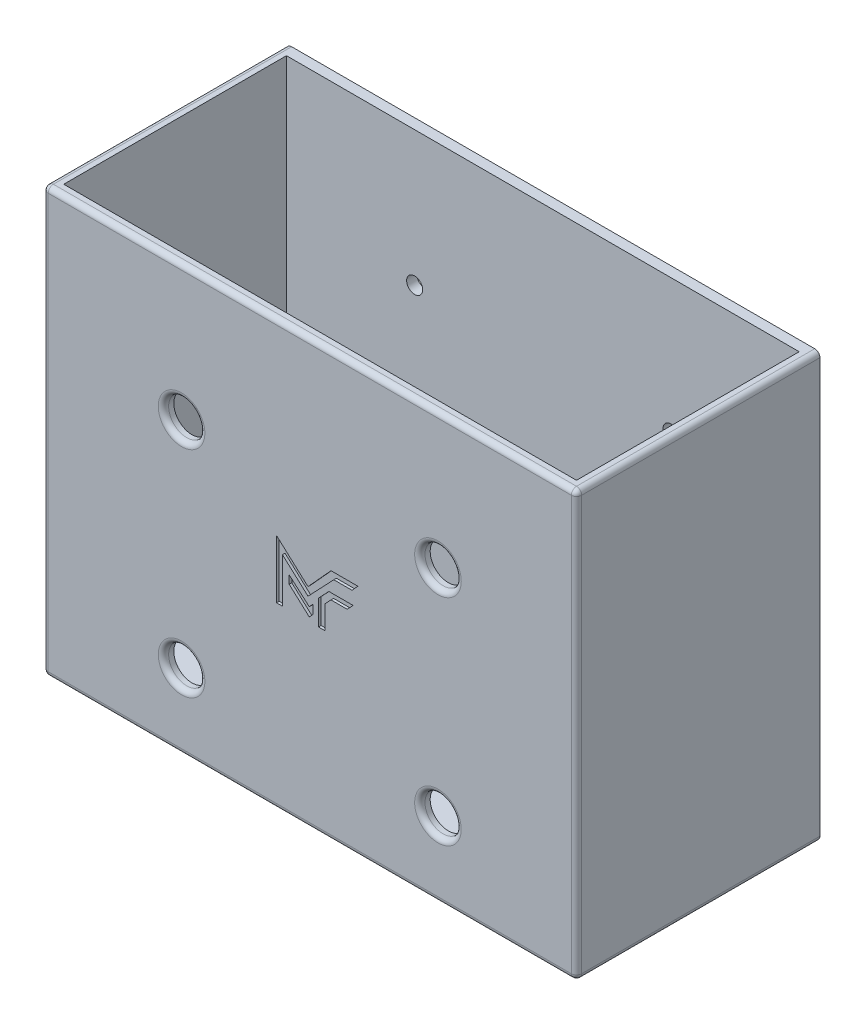
from build123d import *

# Parameters (mm, degrees)
ESBO_O1_W                = 103
ESBO_O1_H                = 47
RESSALTO_EXTRUS_O1_DEPTH = 2
ESBO_O2_W                = 103
ESBO_O2_H                = 47
ESBO_O2_W_2              = 99
ESBO_O2_H_2              = 43
RESSALTO_EXTRUS_O2_DEPTH = 80
ESBO_O3_W                = 99
ESBO_O3_H                = 3
RESSALTO_EXTRUS_O3_DEPTH = 3
FILETE1_R                = 5
ESBO_O4_R                = 1.55
CORTE_EXTRUS_O1_DEPTH    = 3
ESBO_O5_R                = 3.5
CORTE_EXTRUS_O2_DEPTH    = 3
FILETE2_R                = 1
FILETE3_R                = 1
CORTE_EXTRUS_O3_DEPTH    = 3
FILETE4_R                = 1
CORTE_EXTRUS_O4_DEPTH    = 0.5
CORTE_EXTRUS_O5_DEPTH    = 0.5


# Some blends are built 0.0001 mm under size
with BuildPart() as part:
    # Esboço1 → Ressalto-extrusão1 (new body)
    with BuildSketch(Plane(origin=(0, 0, 0), x_dir=(1, 0, 0), z_dir=(0, 1, 0))):
        with Locations((0, 23.5)):
            Rectangle(ESBO_O1_W, ESBO_O1_H)
    extrude(amount=-RESSALTO_EXTRUS_O1_DEPTH)

    # Esboço2 → Ressalto-extrusão2 (add)
    with BuildSketch(Plane(origin=(0, 0, 0), x_dir=(1, 0, 0), z_dir=(0, 1, 0))):
        with Locations((0, 23.5)):
            Rectangle(ESBO_O2_W, ESBO_O2_H)
        with Locations((0, 23.5)):
            Rectangle(ESBO_O2_W_2, ESBO_O2_H_2, mode=Mode.SUBTRACT)
    extrude(amount=RESSALTO_EXTRUS_O2_DEPTH)

    # Esboço3 → Ressalto-extrusão3 (add)
    with BuildSketch(Plane.XY.offset(-45)):
        with Locations((0, 26.5)):
            Rectangle(ESBO_O3_W, ESBO_O3_H)
    extrude(amount=RESSALTO_EXTRUS_O3_DEPTH)

    # Filete1
    # the kernel refuses this fillet: 5 mm, written as the material it adds along each edge
    with BuildSketch(Plane(origin=(49.5, 25, -45), x_dir=(0, -1, 0), z_dir=(-1, 0, 0))) as filete1_piece_1:
        with BuildLine():
            CenterArc((4.582575695, 5), FILETE1_R, 203.578178478, 66.421821522)
            Line((0, 3), (-0.091651514, 2.96))
            ThreePointArc((-0.091651514, 2.96), (-0.1, 1.5), (-0.1, 0))
            Line((-0.1, 0), (0, -0.1))
            Line((0, -0.1), (4.582575695, -0.1))
            Line((4.582575695, -0.1), (4.582575695, 0))
        make_face()
    extrude(amount=99)

    # Esboço4 → Corte-extrusão1 (cut)
    with BuildSketch(Plane.XY.offset(-45)):
        with Locations((24.75, 12.5)):
            Circle(ESBO_O4_R)
        with Locations((24.75, 54)):
            Circle(ESBO_O4_R)
        with Locations(Location((-24.75, 12.5, 0), (0, 0, 180))):
            Circle(ESBO_O4_R)
        with Locations(Location((-24.75, 54, 0), (0, 0, 180))):
            Circle(ESBO_O4_R)
    extrude(amount=-CORTE_EXTRUS_O1_DEPTH, mode=Mode.SUBTRACT)

    # Esboço5 → Corte-extrusão2 (cut)
    with BuildSketch(Plane.XY):
        with Locations((-24.75, 54)):
            Circle(ESBO_O5_R)
        with Locations((24.75, 54)):
            Circle(ESBO_O5_R)
        with Locations((-24.75, 12.5)):
            Circle(ESBO_O5_R)
        with Locations((24.75, 12.5)):
            Circle(ESBO_O5_R)
    extrude(amount=-CORTE_EXTRUS_O2_DEPTH, mode=Mode.SUBTRACT)

    # Filete2
    filete2_edges = [part.edges().sort_by_distance(p)[0] for p in [
        (21.25, 54, 0),
        (-28.25, 12.5, 0),
        (21.25, 12.5, 0),
        (-28.25, 54, 0),
    ]]
    fillet(filete2_edges, radius=FILETE2_R)

    # Filete3
    filete3_edges = [part.edges().sort_by_distance(p)[0] for p in [
        (-51.5, -2, -23.5),
        (51.5, 80, -23.5),
        (0, -2, 0),
        (-51.5, 80, -23.5),
        (0, 80, 0),
        (51.5, -2, -23.5),
        (51.5, 39, 0),
        (-51.5, 39, 0),
    ]]
    fillet(filete3_edges, radius=FILETE3_R)

    # Esboço6 → Corte-extrusão3 (cut)
    with BuildSketch(Plane.XZ.offset(2)):
        with BuildLine():
            Line((12, -17.5), (32, -17.5))
            ThreePointArc((32, -17.5), (38, -23.5), (32, -29.5))
            Line((32, -29.5), (12, -29.5))
            ThreePointArc((12, -29.5), (6, -23.5), (12, -17.5))
        make_face()
        with BuildLine():
            Line((-12, -17.5), (-32, -17.5))
            ThreePointArc((-32, -17.5), (-38, -23.5), (-32, -29.5))
            Line((-32, -29.5), (-12, -29.5))
            ThreePointArc((-12, -29.5), (-6, -23.5), (-12, -17.5))
        make_face()
    extrude(amount=-CORTE_EXTRUS_O3_DEPTH, mode=Mode.SUBTRACT)

    # Filete4
    filete4_edges = [part.edges().sort_by_distance(p)[0] for p in [
        (22, -2, -17.5),
        (38, -2, -23.5),
        (22, -2, -29.5),
        (-22, -2, -17.5),
        (-6, -2, -23.5),
        (-22, -2, -29.5),
        (6, -2, -23.5),
        (-38, -2, -23.5),
        (6, 0, -23.5),
        (22, 0, -29.5),
        (38, 0, -23.5),
        (-38, 0, -23.5),
        (-22, 0, -29.5),
        (-6, 0, -23.5),
        (22, 0, -17.5),
        (-22, 0, -17.5),
    ]]
    fillet(filete4_edges, radius=FILETE4_R - 0.0001)  # a hair under: the kernel refuses the full size

    # Esboço7 → Corte-extrusão4 (cut)
    # profile 1 of 4: a face of its own
    with BuildSketch(Plane.XZ.offset(2)):
        with BuildLine():
            Line((-18.301282051, -9.607171474), (-18.761919071, -10.047475962))
            add(Edge.make_bspline(
                [(-18.761919071, -10.047475962), (-18.800994055, -10.007072362), (-18.877319742, -9.928151474), (-19.000309147, -9.823667173), (-19.12821365, -9.736593645), (-19.258545124, -9.663260875), (-19.393647856, -9.607779407), (-19.531959688, -9.567349128), (-19.674363783, -9.542700314), (-19.770737398, -9.539880054), (-19.819210737, -9.538461538)],
                knots=[0, 0, 0, 0, 1.115251505, 2.178435587, 3.19620269, 4.182487026, 5.141301733, 6.088180966, 7.038406374, 8, 8, 8, 8], degree=3))
            add(Edge.make_bspline(
                [(-19.819210737, -9.538461538), (-19.859691866, -9.539582215), (-19.939576915, -9.541793747), (-20.0568691, -9.558006457), (-20.169065136, -9.585576876), (-20.27654909, -9.623574021), (-20.379004683, -9.67274031), (-20.476646728, -9.733037689), (-20.569234492, -9.803921587), (-20.655544944, -9.885025248), (-20.734498712, -9.973637093), (-20.804259394, -10.068185719), (-20.862695155, -10.168454522), (-20.910652433, -10.273428053), (-20.948009299, -10.383592182), (-20.974686795, -10.49887274), (-20.990116346, -10.61940702), (-20.99241931, -10.701345325), (-20.993589744, -10.742988782)],
                knots=[0, 0, 0, 0, 1.035432265, 2.043311493, 3.022114605, 3.98653278, 4.95457646, 5.923598177, 6.917315552, 7.932509744, 8.948865224, 9.949768934, 10.933144597, 11.912367597, 12.897413939, 13.903909035, 14.934704909, 16, 16, 16, 16], degree=3))
            add(Edge.make_bspline(
                [(-20.993589744, -10.742988782), (-20.993252438, -10.772217074), (-20.992587601, -10.829826638), (-20.98530979, -10.915047172), (-20.973590798, -10.997731236), (-20.956630512, -11.077753588), (-20.935421509, -11.155183575), (-20.910538518, -11.23068918), (-20.879323173, -11.303227088), (-20.844673668, -11.373639779), (-20.804376694, -11.440005953), (-20.760929122, -11.503291609), (-20.713817323, -11.563186525), (-20.662736153, -11.61944585), (-20.606966706, -11.671190376), (-20.547950417, -11.719976123), (-20.484691762, -11.764581818), (-20.418504785, -11.80612689), (-20.348817713, -11.842217448), (-20.277521318, -11.874908521), (-20.203534604, -11.901458533), (-20.127758402, -11.922860265), (-20.05046351, -11.941059241), (-19.970893913, -11.95226491), (-19.889739379, -11.960750832), (-19.834892536, -11.961274788), (-19.807291667, -11.961538462)],
                knots=[0, 0, 0, 0, 1.103660481, 2.175337485, 3.227646561, 4.255952547, 5.262355991, 6.258840057, 7.255597736, 8.242457506, 9.22035537, 10.185017736, 11.140346927, 12.096287581, 13.051739095, 14.01125915, 14.986044842, 15.97314143, 16.960198552, 17.947847494, 18.933482797, 19.925264591, 20.920966487, 21.929612487, 22.958107872, 24, 24, 24, 24], degree=3))
            add(Edge.make_bspline(
                [(-19.807291667, -11.961538462), (-19.76047585, -11.9601843), (-19.668494943, -11.957523724), (-19.533499738, -11.936718397), (-19.404862755, -11.902494811), (-19.302082422, -11.862078745), (-19.221556746, -11.822167355), (-19.160253739, -11.785251285), (-19.096861652, -11.743956608), (-19.032433373, -11.696724817), (-18.966244212, -11.644122713), (-18.89946256, -11.584998212), (-18.830378795, -11.521298199), (-18.785122706, -11.475834248), (-18.761919071, -11.452524038)],
                knots=[0, 0, 0, 0, 1.404581149, 2.759636711, 4.088442092, 5.392261763, 6.066678138, 6.783632037, 7.538459478, 8.336747902, 9.180226004, 10.074962426, 11.012997595, 12, 12, 12, 12], degree=3))
            Line((-18.761919071, -11.452524038), (-18.315304487, -11.921574519))
            add(Edge.make_bspline(
                [(-18.315304487, -11.921574519), (-18.346699088, -11.951885021), (-18.407974636, -12.011044639), (-18.500407099, -12.095045775), (-18.592723232, -12.170530135), (-18.682692869, -12.240237468), (-18.771789808, -12.302137032), (-18.860004599, -12.356290645), (-18.946338612, -12.404067932), (-19.032584602, -12.444663151), (-19.119279235, -12.479132709), (-19.208477824, -12.508808735), (-19.300453058, -12.533913586), (-19.395766679, -12.554169904), (-19.493529661, -12.570412736), (-19.594656934, -12.581376554), (-19.698507303, -12.588747163), (-19.768950617, -12.589409474), (-19.804487179, -12.58974359)],
                knots=[0, 0, 0, 0, 1.244526981, 2.429050516, 3.560637417, 4.644440555, 5.67424972, 6.652764056, 7.595344123, 8.486817594, 9.369275933, 10.254498637, 11.166417451, 12.086725134, 13.032340136, 13.991389299, 14.986715468, 16, 16, 16, 16], degree=3))
            add(Edge.make_bspline(
                [(-19.804487179, -12.58974359), (-19.869763443, -12.588079568), (-19.997490947, -12.584823539), (-20.184672274, -12.56069857), (-20.36248951, -12.520253485), (-20.531375251, -12.463052978), (-20.691275795, -12.389982012), (-20.842150235, -12.300400439), (-20.983755395, -12.194546263), (-21.114947384, -12.073660197), (-21.233616782, -11.940151686), (-21.338506787, -11.796800172), (-21.425271803, -11.642901134), (-21.497314666, -11.480728154), (-21.553651237, -11.309541172), (-21.593302632, -11.129155018), (-21.617755358, -10.939743864), (-21.620430521, -10.810371679), (-21.621794872, -10.744391026)],
                knots=[0, 0, 0, 0, 1.078019885, 2.10938526, 3.111377082, 4.085535484, 5.04941344, 6.010039228, 6.978205633, 7.964457913, 8.951525778, 9.924444315, 10.892603023, 11.863865945, 12.85144698, 13.863884204, 14.910567087, 16, 16, 16, 16], degree=3))
            add(Edge.make_bspline(
                [(-21.621794872, -10.744391026), (-21.621218363, -10.701359006), (-21.620075865, -10.616080062), (-21.608068097, -10.490457267), (-21.591328571, -10.367997513), (-21.564772836, -10.249972337), (-21.532762515, -10.134791723), (-21.492953476, -10.023707549), (-21.445409299, -9.916400549), (-21.391662445, -9.812691083), (-21.330859166, -9.71325856), (-21.262935229, -9.618957263), (-21.18963926, -9.529059201), (-21.109210077, -9.444757041), (-21.022816421, -9.365310593), (-20.930068235, -9.291150392), (-20.831523352, -9.221212897), (-20.726915049, -9.157301627), (-20.618275586, -9.099490486), (-20.506975192, -9.048498591), (-20.393287319, -9.005881109), (-20.277692652, -8.970531479), (-20.159702802, -8.944145481), (-20.040159952, -8.924172131), (-19.918046935, -8.913006901), (-19.836058624, -8.911179081), (-19.794671474, -8.91025641)],
                knots=[0, 0, 0, 0, 1.071919942, 2.124283339, 3.142214191, 4.149696895, 5.136002878, 6.119640489, 7.086990633, 8.058538607, 9.028339693, 9.988281803, 10.952401235, 11.916291999, 12.888973767, 13.874849856, 14.873389453, 15.898127285, 16.927174885, 17.938320013, 18.946391617, 19.950418109, 20.947802303, 21.956882652, 22.968648068, 24, 24, 24, 24], degree=3))
            add(Edge.make_bspline(
                [(-19.794671474, -8.91025641), (-19.759363992, -8.910785308), (-19.689116127, -8.911837605), (-19.584505268, -8.920609646), (-19.480731038, -8.934386047), (-19.37816498, -8.955171702), (-19.276073437, -8.979846901), (-19.175798006, -9.012155671), (-19.075756788, -9.048169883), (-18.977518782, -9.091217521), (-18.88094686, -9.138207905), (-18.788303373, -9.191520203), (-18.698032845, -9.247873635), (-18.612135617, -9.310603444), (-18.529002648, -9.377434303), (-18.449068648, -9.448678016), (-18.373035085, -9.525522424), (-18.325320643, -9.579817534), (-18.301282051, -9.607171474)],
                knots=[0, 0, 0, 0, 0.996412454, 1.982464992, 2.961075852, 3.949442424, 4.934965278, 5.923860011, 6.921385422, 7.934793307, 8.949617135, 9.951082467, 10.950285876, 11.951772932, 12.951063433, 13.960125323, 14.972308753, 16, 16, 16, 16], degree=3))
        make_face()
    # profile 2 of 4: a face of its own
    with BuildSketch(Plane.XZ.offset(2)):
        Polygon((-23.955829327, -9), (-23.371794872, -9), (-21.958333333, -12.5), (-22.629306891, -12.5), (-22.901342147, -11.782051282), (-24.424879808, -11.782051282), (-24.697616186, -12.5), (-25.368589744, -12.5), align=None)
        Polygon((-23.663461538, -9.938802083), (-24.186498397, -11.153846154), (-23.139723558, -11.153846154), align=None, mode=Mode.SUBTRACT)
    # profile 3 of 4: a face of its own
    with BuildSketch(Plane.XZ.offset(2)):
        with BuildLine():
            Line((19.25, -9), (20.041566506, -9))
            add(Edge.make_bspline(
                [(20.041566506, -9), (20.10327822, -9.000431386), (20.222567661, -9.00126526), (20.395394461, -9.010661015), (20.556101392, -9.025111019), (20.704792049, -9.044989618), (20.841161593, -9.071294448), (20.965034178, -9.104288702), (21.076825549, -9.142375078), (21.177761476, -9.187191429), (21.269906269, -9.239442844), (21.357400691, -9.297646725), (21.440072949, -9.36393525), (21.519083216, -9.437029582), (21.593411849, -9.518266959), (21.664296686, -9.606301796), (21.730002143, -9.70241072), (21.792514356, -9.804289341), (21.849048335, -9.912369411), (21.898359383, -10.025730976), (21.939667547, -10.143644511), (21.97323257, -10.266235682), (21.999987767, -10.393097523), (22.018707839, -10.52448603), (22.030280774, -10.660279558), (22.031454751, -10.7523135), (22.032051282, -10.799078526)],
                knots=[0, 0, 0, 0, 1.44355588, 2.790409838, 4.047694926, 5.217575253, 6.298404546, 7.294384826, 8.214239204, 9.058592145, 9.873746385, 10.689560431, 11.514393297, 12.350027578, 13.205127629, 14.088021785, 14.991911688, 15.926770944, 16.882954281, 17.842803888, 18.816321264, 19.80318086, 20.814351908, 21.847355356, 22.906180909, 24, 24, 24, 24], degree=3))
            add(Edge.make_bspline(
                [(22.032051282, -10.799078526), (22.030489242, -10.865067021), (22.027414275, -10.994969237), (22.001512472, -11.185599243), (21.959620485, -11.368337116), (21.900716547, -11.541753411), (21.827691432, -11.704303829), (21.740454754, -11.853121863), (21.640285608, -11.987408732), (21.528350968, -12.106495799), (21.407153016, -12.208852746), (21.281203903, -12.296513981), (21.149276656, -12.365642179), (21.033030315, -12.409479795), (20.932230234, -12.436742999), (20.843728854, -12.452855815), (20.743200316, -12.467632239), (20.629707279, -12.479051142), (20.503747612, -12.489233997), (20.36481924, -12.494766964), (20.213371971, -12.499364038), (20.108177523, -12.499782458), (20.053485577, -12.5)],
                knots=[0, 0, 0, 0, 1.315458931, 2.589557908, 3.828601765, 5.048913369, 6.235739168, 7.376350998, 8.481830359, 9.569842114, 10.627874879, 11.640079404, 12.624025415, 13.590060155, 14.111227486, 14.704434459, 15.382649715, 16.137166398, 16.978595427, 17.902333227, 18.909396075, 20, 20, 20, 20], degree=3))
            Line((20.053485577, -12.5), (19.25, -12.5))
            Line((19.25, -12.5), (19.25, -9))
        make_face()
        with BuildLine():
            Line((19.878205128, -9.628205128), (19.878205128, -11.871794872))
            Line((19.878205128, -11.871794872), (20.206330128, -11.871794872))
            add(Edge.make_bspline(
                [(20.206330128, -11.871794872), (20.245371964, -11.871723331), (20.320462411, -11.871585734), (20.42887602, -11.86503188), (20.529131118, -11.858453619), (20.620951728, -11.845967858), (20.705006092, -11.832059598), (20.780139522, -11.812704351), (20.847900844, -11.792373304), (20.907462369, -11.766489361), (20.962015872, -11.73735526), (21.012526184, -11.703221283), (21.061282778, -11.66531679), (21.107374108, -11.622526954), (21.15097462, -11.575418393), (21.191826346, -11.523748379), (21.230474547, -11.467674558), (21.265927198, -11.406900454), (21.29832402, -11.342067854), (21.327063632, -11.273804758), (21.350893011, -11.20154268), (21.370698531, -11.125958081), (21.384851822, -11.04639291), (21.39656097, -10.963436497), (21.402597377, -10.876760174), (21.403425836, -10.817782708), (21.403846154, -10.787860577)],
                knots=[0, 0, 0, 0, 1.50275155, 2.890291501, 4.180787663, 5.369391935, 6.45668281, 7.458360028, 8.354766181, 9.177074746, 9.954075863, 10.732690366, 11.5210699, 12.329727389, 13.151100085, 13.990027547, 14.863562427, 15.770965086, 16.696477834, 17.652329173, 18.619756807, 19.62365428, 20.657822005, 21.729286259, 22.847956731, 24, 24, 24, 24], degree=3))
            add(Edge.make_bspline(
                [(21.403846154, -10.787860577), (21.403009024, -10.74200774), (21.401376685, -10.652598261), (21.385634766, -10.522371404), (21.360009925, -10.399743308), (21.323445745, -10.285169081), (21.277355464, -10.178326708), (21.219662732, -10.080121371), (21.152850424, -9.988903355), (21.100017073, -9.93539194), (21.073617788, -9.908653846)],
                knots=[0, 0, 0, 0, 1.13821349, 2.219428113, 3.251817212, 4.244760574, 5.201143372, 6.134805572, 7.068016741, 8, 8, 8, 8], degree=3))
            add(Edge.make_bspline(
                [(21.073617788, -9.908653846), (21.047585594, -9.885869376), (20.994417785, -9.839334675), (20.901072585, -9.783574203), (20.798211008, -9.734583163), (20.683479891, -9.695738732), (20.557988059, -9.665018899), (20.420988079, -9.643832182), (20.273213618, -9.630217823), (20.170838914, -9.6288904), (20.117988782, -9.628205128)],
                knots=[0, 0, 0, 0, 0.813307809, 1.661089106, 2.549956539, 3.493439533, 4.508053171, 5.589449661, 6.755572447, 8, 8, 8, 8], degree=3))
            Line((20.117988782, -9.628205128), (19.878205128, -9.628205128))
        make_face(mode=Mode.SUBTRACT)
    # profile 4 of 4: a face of its own
    with BuildSketch(Plane.XZ.offset(2)):
        with BuildLine():
            Line((25.801282051, -9.607171474), (25.340645032, -10.047475962))
            add(Edge.make_bspline(
                [(25.340645032, -10.047475962), (25.301570047, -10.007072362), (25.22524436, -9.928151474), (25.102254955, -9.823667173), (24.974350452, -9.736593645), (24.844018978, -9.663260875), (24.708916247, -9.607779407), (24.570604415, -9.567349128), (24.428200319, -9.542700314), (24.331826705, -9.539880054), (24.283353365, -9.538461538)],
                knots=[0, 0, 0, 0, 1.115251505, 2.178435587, 3.19620269, 4.182487026, 5.141301733, 6.088180966, 7.038406374, 8, 8, 8, 8], degree=3))
            add(Edge.make_bspline(
                [(24.283353365, -9.538461538), (24.242872236, -9.539582215), (24.162987188, -9.541793747), (24.045695003, -9.558006457), (23.933498966, -9.585576876), (23.826015013, -9.623574021), (23.723559419, -9.67274031), (23.625917374, -9.733037689), (23.53332961, -9.803921587), (23.447019159, -9.885025248), (23.36806539, -9.973637093), (23.298304709, -10.068185719), (23.239868948, -10.168454522), (23.191911669, -10.273428053), (23.154554803, -10.383592182), (23.127877307, -10.49887274), (23.112447757, -10.61940702), (23.110144793, -10.701345325), (23.108974359, -10.742988782)],
                knots=[0, 0, 0, 0, 1.035432265, 2.043311493, 3.022114605, 3.98653278, 4.95457646, 5.923598177, 6.917315552, 7.932509744, 8.948865224, 9.949768934, 10.933144597, 11.912367597, 12.897413939, 13.903909035, 14.934704909, 16, 16, 16, 16], degree=3))
            add(Edge.make_bspline(
                [(23.108974359, -10.742988782), (23.109311665, -10.772217074), (23.109976501, -10.829826638), (23.117254313, -10.915047172), (23.128973305, -10.997731236), (23.14593359, -11.077753588), (23.167142594, -11.155183575), (23.192025584, -11.23068918), (23.22324093, -11.303227088), (23.257890434, -11.373639779), (23.298187408, -11.440005953), (23.341634981, -11.503291609), (23.388746779, -11.563186525), (23.43982795, -11.61944585), (23.495597397, -11.671190376), (23.554613686, -11.719976123), (23.61787234, -11.764581818), (23.684059317, -11.80612689), (23.753746389, -11.842217448), (23.825042784, -11.874908521), (23.899029499, -11.901458533), (23.974805701, -11.922860265), (24.052100593, -11.941059241), (24.13167019, -11.95226491), (24.212824724, -11.960750832), (24.267671567, -11.961274788), (24.295272436, -11.961538462)],
                knots=[0, 0, 0, 0, 1.103660481, 2.175337485, 3.227646561, 4.255952547, 5.262355991, 6.258840057, 7.255597736, 8.242457506, 9.22035537, 10.185017736, 11.140346927, 12.096287581, 13.051739095, 14.01125915, 14.986044842, 15.97314143, 16.960198552, 17.947847494, 18.933482797, 19.925264591, 20.920966487, 21.929612487, 22.958107872, 24, 24, 24, 24], degree=3))
            add(Edge.make_bspline(
                [(24.295272436, -11.961538462), (24.342088253, -11.9601843), (24.434069159, -11.957523724), (24.569064365, -11.936718397), (24.697701347, -11.902494811), (24.80048168, -11.862078745), (24.881007357, -11.822167355), (24.942310364, -11.785251285), (25.005702451, -11.743956608), (25.07013073, -11.696724817), (25.136319891, -11.644122713), (25.203101543, -11.584998212), (25.272185307, -11.521298199), (25.317441397, -11.475834248), (25.340645032, -11.452524038)],
                knots=[0, 0, 0, 0, 1.404581149, 2.759636711, 4.088442092, 5.392261763, 6.066678138, 6.783632037, 7.538459478, 8.336747902, 9.180226004, 10.074962426, 11.012997595, 12, 12, 12, 12], degree=3))
            Line((25.340645032, -11.452524038), (25.787259615, -11.921574519))
            add(Edge.make_bspline(
                [(25.787259615, -11.921574519), (25.755865014, -11.951885021), (25.694589466, -12.011044639), (25.602157004, -12.095045775), (25.509840871, -12.170530135), (25.419871234, -12.240237468), (25.330774295, -12.302137032), (25.242559504, -12.356290645), (25.15622549, -12.404067932), (25.069979501, -12.444663151), (24.983284868, -12.479132709), (24.894086279, -12.508808735), (24.802111045, -12.533913586), (24.706797423, -12.554169904), (24.609034442, -12.570412736), (24.507907168, -12.581376554), (24.4040568, -12.588747163), (24.333613486, -12.589409474), (24.298076923, -12.58974359)],
                knots=[0, 0, 0, 0, 1.244526981, 2.429050516, 3.560637417, 4.644440555, 5.67424972, 6.652764056, 7.595344123, 8.486817594, 9.369275933, 10.254498637, 11.166417451, 12.086725134, 13.032340136, 13.991389299, 14.986715468, 16, 16, 16, 16], degree=3))
            add(Edge.make_bspline(
                [(24.298076923, -12.58974359), (24.232800659, -12.588079568), (24.105073155, -12.584823539), (23.917891829, -12.56069857), (23.740074593, -12.520253485), (23.571188852, -12.463052978), (23.411288308, -12.389982012), (23.260413867, -12.300400439), (23.118808707, -12.194546263), (22.987616718, -12.073660197), (22.86894732, -11.940151686), (22.764057315, -11.796800172), (22.677292299, -11.642901134), (22.605249437, -11.480728154), (22.548912866, -11.309541172), (22.50926147, -11.129155018), (22.484808744, -10.939743864), (22.482133581, -10.810371679), (22.480769231, -10.744391026)],
                knots=[0, 0, 0, 0, 1.078019885, 2.10938526, 3.111377082, 4.085535484, 5.04941344, 6.010039228, 6.978205633, 7.964457913, 8.951525778, 9.924444315, 10.892603023, 11.863865945, 12.85144698, 13.863884204, 14.910567087, 16, 16, 16, 16], degree=3))
            add(Edge.make_bspline(
                [(22.480769231, -10.744391026), (22.481345739, -10.701359006), (22.482488238, -10.616080062), (22.494496005, -10.490457267), (22.511235531, -10.367997513), (22.537791267, -10.249972337), (22.569801587, -10.134791723), (22.609610626, -10.023707549), (22.657154803, -9.916400549), (22.710901658, -9.812691083), (22.771704936, -9.71325856), (22.839628874, -9.618957263), (22.912924843, -9.529059201), (22.993354026, -9.444757041), (23.079747682, -9.365310593), (23.172495868, -9.291150392), (23.27104075, -9.221212897), (23.375649054, -9.157301627), (23.484288517, -9.099490486), (23.595588911, -9.048498591), (23.709276783, -9.005881109), (23.824871451, -8.970531479), (23.942861301, -8.944145481), (24.062404151, -8.924172131), (24.184517167, -8.913006901), (24.266505479, -8.911179081), (24.307892628, -8.91025641)],
                knots=[0, 0, 0, 0, 1.071919942, 2.124283339, 3.142214191, 4.149696895, 5.136002878, 6.119640489, 7.086990633, 8.058538607, 9.028339693, 9.988281803, 10.952401235, 11.916291999, 12.888973767, 13.874849856, 14.873389453, 15.898127285, 16.927174885, 17.938320013, 18.946391617, 19.950418109, 20.947802303, 21.956882652, 22.968648068, 24, 24, 24, 24], degree=3))
            add(Edge.make_bspline(
                [(24.307892628, -8.91025641), (24.34320011, -8.910785308), (24.413447975, -8.911837605), (24.518058834, -8.920609646), (24.621833065, -8.934386047), (24.724399123, -8.955171702), (24.826490666, -8.979846901), (24.926766097, -9.012155671), (25.026807314, -9.048169883), (25.125045321, -9.091217521), (25.221617243, -9.138207905), (25.31426073, -9.191520203), (25.404531258, -9.247873635), (25.490428486, -9.310603444), (25.573561455, -9.377434303), (25.653495454, -9.448678016), (25.729529017, -9.525522424), (25.777243459, -9.579817534), (25.801282051, -9.607171474)],
                knots=[0, 0, 0, 0, 0.996412454, 1.982464992, 2.961075852, 3.949442424, 4.934965278, 5.923860011, 6.921385422, 7.934793307, 8.949617135, 9.951082467, 10.950285876, 11.951772932, 12.951063433, 13.960125323, 14.972308753, 16, 16, 16, 16], degree=3))
        make_face()
    extrude(amount=-CORTE_EXTRUS_O4_DEPTH, mode=Mode.SUBTRACT)

    # Logo_MF → Corte-extrusão5 (cut)
    with BuildSketch(Plane.XY):
        Polygon((-6.412650279, 32.565433936), (-5.279058726, 32.565433936), (-5.279058726, 41.185329314), (-0.340076926, 36.698837038), (4.643002609, 41.941697965), (8.161859721, 41.941697965), (9.289841241, 43.183443153), (4.099342664, 43.183443153), (-0.338267392, 38.298273637), (-6.412650279, 43.816146147), align=None)
        Polygon((-3.970410445, 38.446133019), (-3.970410445, 36.875636394), (-0.089962746, 33.350699609), (0.590941274, 34.100276863), (0.590941274, 35.820396589), (-0.091081644, 35.069587588), align=None)
        Polygon((1.690941274, 32.565433936), (1.690941274, 37.407455431), (3.690919541, 39.511697965), (8.374408137, 39.511697965), (7.222026693, 38.299239764), (4.099823323, 38.299239764), (2.905968672, 37.043146246), (2.905968672, 32.565433936), align=None)
    extrude(amount=-CORTE_EXTRUS_O5_DEPTH, mode=Mode.SUBTRACT)


solid = part.part
